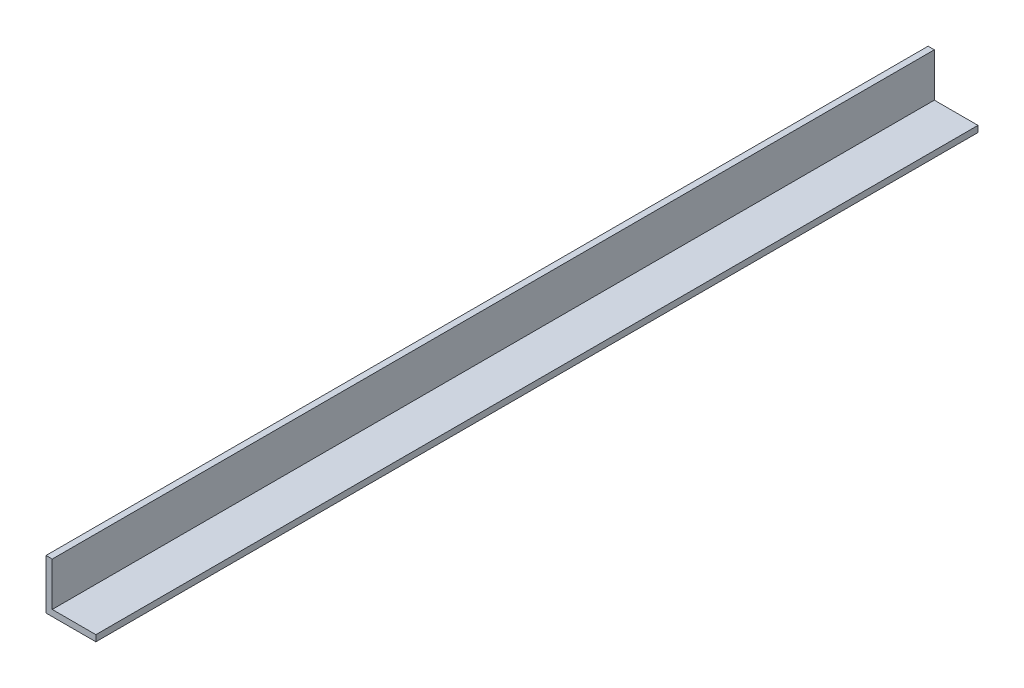
from build123d import *

# Parameters (mm, degrees)
BOSS_EXTRUDE1_DEPTH = 224.6


with BuildPart() as part:
    # Sketch1 → Boss-Extrude1 (new, symmetric)
    with BuildSketch(Plane.XY):
        Polygon((0, 25.4), (0, 0), (25.4, 0), (25.4, 3.175), (3.175, 3.175), (3.175, 25.4), align=None)
    extrude(amount=BOSS_EXTRUDE1_DEPTH, both=True)


solid = part.part
